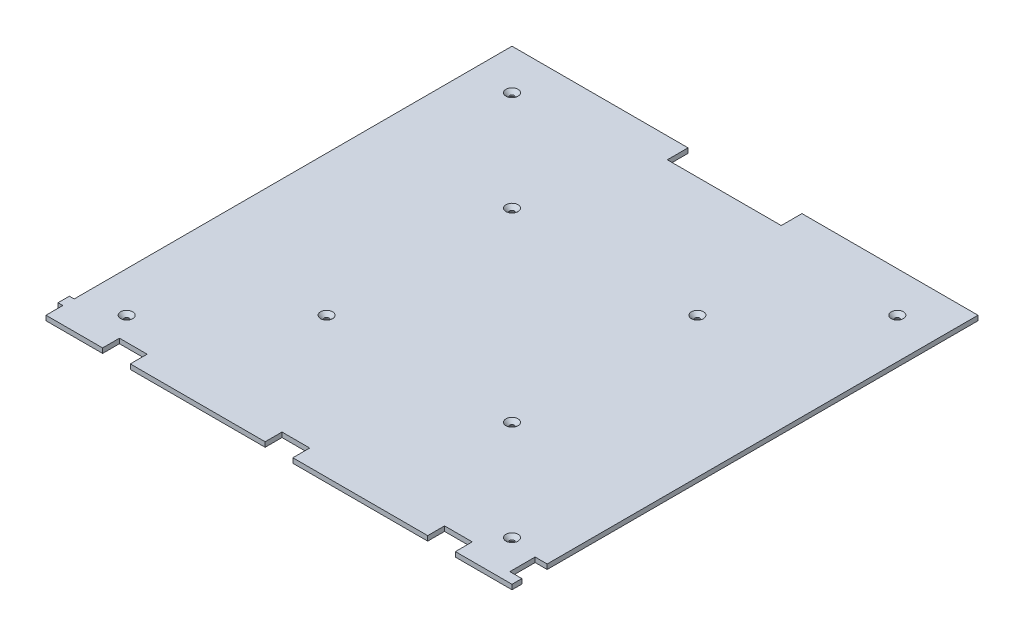
from build123d import *

# Parameters (mm, degrees)
BOSS_EXTRUDE1_DEPTH     = 2
CUT_EXTRUDE1_DEPTH      = 139.261075506
CUT_EXTRUDE1_DEPTH_BACK = 139.261075506
SKETCH2_R               = 1
CHAMFER1_SIZE           = 1.5
SKETCH3_W               = 10
SKETCH3_H               = 41
CUT_EXTRUDE2_DEPTH      = 1.4


with BuildPart() as part:
    # Sketch1 → Boss-Extrude1 (new body)
    with BuildSketch(Plane(origin=(0, 0, 0), x_dir=(1, 0, 0), z_dir=(0, 1, 0))):
        Polygon((5.75, -96.75), (61.746519787, -96.75), (61.746519787, -89.753578842), (73.246519787, -89.753578842), (73.246519787, -96.75), (96.75, -96.75), (96.75, -92.65), (91.75, -92.65), (91.75, -82.15), (96.75, -82.15), (96.75, 96.75), (23.65, 96.75), (23.65, 88.15), (-23.65, 88.15), (-23.65, 96.75), (-96.75, 96.75), (-96.75, -85.05), (-98.75, -85.05), (-98.75, -89.75), (-96.75, -89.75), (-96.75, -96.75), (-73.246519787, -96.75), (-73.246519787, -89.753578842), (-61.746519787, -89.753578842), (-61.746519787, -96.75), (-5.75, -96.75), (-5.75, -89.753578842), (5.75, -89.753578842), align=None)
    extrude(amount=BOSS_EXTRUDE1_DEPTH)

    # Sketch2 → Cut-Extrude1 (cut, two sides: drawn at the far end of the back side and taken through both)
    with BuildSketch(Plane.XZ.offset(-CUT_EXTRUDE1_DEPTH_BACK)):
        with Locations((80, 80)):
            Circle(SKETCH2_R)
        with Locations((-80, 80)):
            Circle(SKETCH2_R)
        with Locations((-38.5, 38.5)):
            Circle(SKETCH2_R)
        with Locations((38.5, 38.5)):
            Circle(SKETCH2_R)
        with Locations((80, -80)):
            Circle(SKETCH2_R)
        with Locations((-80, -80)):
            Circle(SKETCH2_R)
        with Locations((38.5, -38.5)):
            Circle(SKETCH2_R)
        with Locations((-38.5, -38.5)):
            Circle(SKETCH2_R)
    extrude(amount=CUT_EXTRUDE1_DEPTH + CUT_EXTRUDE1_DEPTH_BACK, mode=Mode.SUBTRACT)

    # Chamfer1
    chamfer1_edges = [part.edges().sort_by_distance(p)[0] for p in [
        (79, 2, 80),
        (-81, 2, 80),
        (37.5, 2, 38.5),
        (-39.5, 2, 38.5),
        (-39.5, 2, -38.5),
        (79, 2, -80),
        (37.5, 2, -38.5),
        (-81, 2, -80),
    ]]
    chamfer(chamfer1_edges, length=CHAMFER1_SIZE)

    # Sketch3 → Cut-Extrude2 (cut)
    with BuildSketch(Plane.XZ):
        with Locations((-38.75, -0.25)):
            Rectangle(SKETCH3_W, SKETCH3_H)
    extrude(amount=-CUT_EXTRUDE2_DEPTH, mode=Mode.SUBTRACT)


solid = part.part
